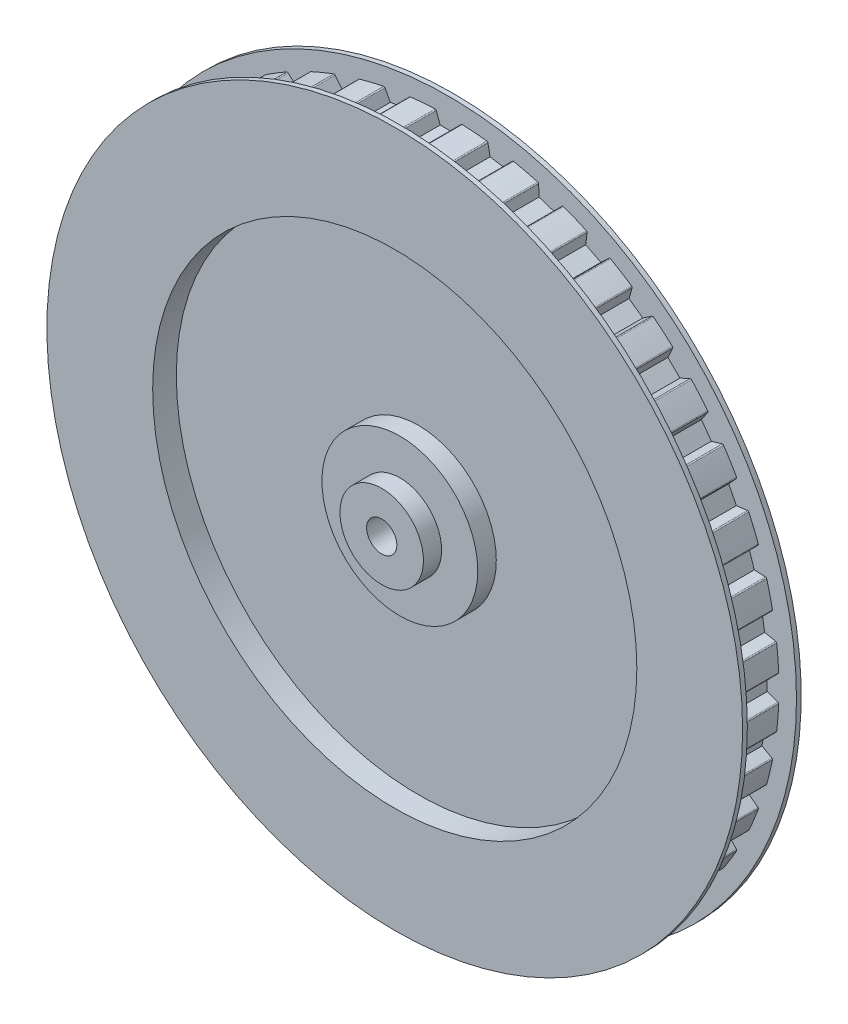
from build123d import *

# Parameters (mm, degrees)
SKETCH1_W               = 63.5
SKETCH1_H               = 1.984375
BOSS_EXTRUDE1_DEPTH     = 20.6375
BOSS_EXTRUDE2_START     = -1.984375
SKETCH3_R               = 63.5
BOSS_EXTRUDE2_DEPTH     = 1.984375
HOLE1_D                 = 88.382475
HOLE1_DEPTH             = 9.921875
HOLE2_D                 = 88.382475
HOLE2_DEPTH             = 9.921875
SKETCH8_W               = 14.2875
SKETCH8_H               = 9.921875
FILLET1_R               = 0.2286
CUT_EXTRUDE1_DEPTH      = 20.6502
CIRPATTERN2_COUNT       = 40
SCALE1_SCALE_X          = 2.3
SCALE1_SCALE_Y          = 2.3
SCALE1_SCALE_Z          = 1
CUT_EXTRUDE2_DEPTH      = 208.309752453
CUT_EXTRUDE2_DEPTH_BACK = 208.309752453
SKETCH13_R              = 6.35


with BuildPart() as part:
    # Sketch1 → Revolve1 (revolve)
    with BuildSketch(Plane(origin=(0, 0, 0), x_dir=(1, 0, 0), z_dir=(0, 1, 0))):
        with Locations((31.75, -11.3109375)):
            Rectangle(SKETCH1_W, SKETCH1_H)
    revolve(axis=Axis((0, 0, 10.31875), (0, 0, 1)))

    # Sketch2 → Boss-Extrude1 (add)
    with BuildSketch(Plane(origin=(0, 0, 10.31875), x_dir=(-1, 0, 0), z_dir=(0, 0, -1))):
        with BuildLine():
            Line((20.814765597, -56.586407632), (19.445887203, -54.834323187))
            Line((19.445887203, -54.834323187), (16.498753271, -55.791905049))
            Line((16.498753271, -55.791905049), (16.421156785, -58.013977673))
            ThreePointArc((16.421156785, -58.013977673), (-4.730553873, -60.107386032), (-25.294370657, -54.730894462))
            Line((-25.294370657, -54.730894462), (-25.02340306, -52.524040475))
            Line((-25.02340306, -52.524040475), (-27.784454077, -51.117214714))
            Line((-27.784454077, -51.117214714), (-29.410565699, -52.633588333))
            ThreePointArc((-29.410565699, -52.633588333), (-42.633765935, -42.633765935), (-52.633588333, -29.410565699))
            Line((-52.633588333, -29.410565699), (-51.117214714, -27.784454077))
            Line((-51.117214714, -27.784454077), (-52.524040475, -25.02340306))
            Line((-52.524040475, -25.02340306), (-54.730894462, -25.294370657))
            ThreePointArc((-54.730894462, -25.294370657), (-60.107386032, -4.730553873), (-58.013977673, 16.421156785))
            Line((-58.013977673, 16.421156785), (-55.791905049, 16.498753271))
            Line((-55.791905049, 16.498753271), (-54.834323187, 19.445887203))
            Line((-54.834323187, 19.445887203), (-56.586407632, 20.814765597))
            ThreePointArc((-56.586407632, 20.814765597), (-48.778263896, 35.439483163), (-37.282180065, 47.384755409))
            Line((-37.282180065, 47.384755409), (-35.43887548, 46.141430767))
            Line((-35.43887548, 46.141430767), (-32.931893617, 47.962859707))
            Line((-32.931893617, 47.962859707), (-33.544753177, 50.100154988))
            ThreePointArc((-33.544753177, 50.100154988), (-14.075179684, 58.627342703), (7.143599533, 59.868564216))
            Line((7.143599533, 59.868564216), (7.56784942, 57.685987758))
            Line((7.56784942, 57.685987758), (10.62849805, 57.201228638))
            Line((10.62849805, 57.201228638), (11.706436886, 59.145881776))
            ThreePointArc((11.706436886, 59.145881776), (27.372562698, 53.721679115), (40.969152545, 44.235783426))
            Line((40.969152545, 44.235783426), (40.02949166, 42.220674153))
            Line((40.02949166, 42.220674153), (42.220674153, 40.02949166))
            Line((42.220674153, 40.02949166), (44.235783426, 40.969152545))
            ThreePointArc((44.235783426, 40.969152545), (53.721679115, 27.372562698), (59.145881776, 11.706436886))
            Line((59.145881776, 11.706436886), (57.201228638, 10.62849805))
            Line((57.201228638, 10.62849805), (57.685987758, 7.56784942))
            Line((57.685987758, 7.56784942), (59.868564216, 7.143599533))
            ThreePointArc((59.868564216, 7.143599533), (58.627342703, -14.075179684), (50.100154988, -33.544753177))
            Line((50.100154988, -33.544753177), (47.962859707, -32.931893617))
            Line((47.962859707, -32.931893617), (46.141430767, -35.43887548))
            Line((46.141430767, -35.43887548), (47.384755409, -37.282180065))
            ThreePointArc((47.384755409, -37.282180065), (35.439483163, -48.778263896), (20.814765597, -56.586407632))
        make_face()
    extrude(amount=BOSS_EXTRUDE1_DEPTH)

    # Sketch3 → Boss-Extrude2 (add)
    with BuildSketch(Plane.XY.offset(-10.31875).offset(BOSS_EXTRUDE2_START)):
        Circle(SKETCH3_R)
    extrude(amount=BOSS_EXTRUDE2_DEPTH)

    # Hole1
    with Locations(Plane(origin=(0, 0, -12.303125), x_dir=(-1, 0, 0), z_dir=(0, 0, -1))):
        with Locations((0, 0)):
            Hole(HOLE1_D / 2, depth=HOLE1_DEPTH)

    # Hole2
    with Locations(Plane.XY.offset(12.303125)):
        with Locations((0, 0)):
            Hole(HOLE2_D / 2, depth=HOLE2_DEPTH)

    # Sketch8 → Revolve2 (revolve)
    with BuildSketch(Plane(origin=(0, 0, 0), x_dir=(1, 0, 0), z_dir=(0, 1, 0))):
        with Locations((7.14375, 7.3421875)):
            Rectangle(SKETCH8_W, SKETCH8_H)
    revolve(axis=Axis((0, 0, -12.303125), (0, 0, 1)))

    # Sketch9 → Revolve3 (revolve)
    with BuildSketch(Plane(origin=(0, 0, 0), x_dir=(1, 0, 0), z_dir=(0, 1, 0))):
        Polygon((14.224, 0), (0, 0), (0, -17.78), (7.62, -17.78), (7.62, -10.16), (14.224, -10.16), align=None)
    revolve(axis=Axis((0, 0, 0), (0, 0, 1)))

    # Fillet1
    fillet1_edges = [part.edges().sort_by_distance(p)[0] for p in [
        (-7.143599533, 59.868564216, 0),
        (58.013977673, 16.421156785, 0),
        (52.633588333, -29.410565699, 0),
        (-59.145881776, 11.706436886, 0),
        (37.282180065, 47.384755409, 0),
        (-59.868564216, 7.143599533, 0),
        (-44.235783426, 40.969152545, 0),
        (-50.100154988, -33.544753177, 0),
        (54.730894462, -25.294370657, 0),
        (-47.384755409, -37.282180065, 0),
        (56.586407632, 20.814765597, 0),
        (-20.814765597, -56.586407632, 0),
        (33.544753177, 50.100154988, 0),
        (-16.421156785, -58.013977673, 0),
        (-11.706436886, 59.145881776, 0),
        (25.294370657, -54.730894462, 0),
        (-40.969152545, 44.235783426, 0),
        (29.410565699, -52.633588333, 0),
    ]]
    fillet(fillet1_edges, radius=FILLET1_R)

    # Sketch12 → Cut-Extrude1 (cut)
    with BuildSketch(Plane.XY.offset(-10.31875)):
        with BuildLine():
            Line((35.43887548, 46.141430767), (37.143791211, 47.291410948))
            ThreePointArc((37.143791211, 47.291410948), (37.280307439, 47.330327929), (37.413474745, 47.281158013))
            ThreePointArc((37.413474745, 47.281158013), (35.439530543, 48.778329109), (33.405653911, 50.193010293))
            ThreePointArc((33.405653911, 50.193010293), (33.493568241, 50.081554999), (33.498741827, 49.939694342))
            Line((33.498741827, 49.939694342), (32.931893617, 47.962859707))
            Line((32.931893617, 47.962859707), (35.43887548, 46.141430767))
        make_face()
    cut_extrude1 = extrude(amount=CUT_EXTRUDE1_DEPTH, mode=Mode.SUBTRACT)

    # CirPattern2: Cut-Extrude1 ×40 about axis
    cirpattern2_axis = Axis((0, 0, 12.303125), (0, 0, 1))
    for i in range(1, CIRPATTERN2_COUNT):
        add(cut_extrude1.rotate(cirpattern2_axis, i * 360 / CIRPATTERN2_COUNT), mode=Mode.SUBTRACT)


with BuildPart() as part_1:
    # Scale1: scaled about (0, 0, 0)
    add(part.part.scale((SCALE1_SCALE_X, SCALE1_SCALE_Y, SCALE1_SCALE_Z), about=(0, 0, 0)))

    # Sketch13 → Cut-Extrude2 (cut, two sides: drawn at the far end of the back side and taken through both)
    with BuildSketch(Plane.XY.offset(-CUT_EXTRUDE2_DEPTH_BACK)):
        Circle(SKETCH13_R)
    extrude(amount=CUT_EXTRUDE2_DEPTH + CUT_EXTRUDE2_DEPTH_BACK, mode=Mode.SUBTRACT)


solid = part_1.part
